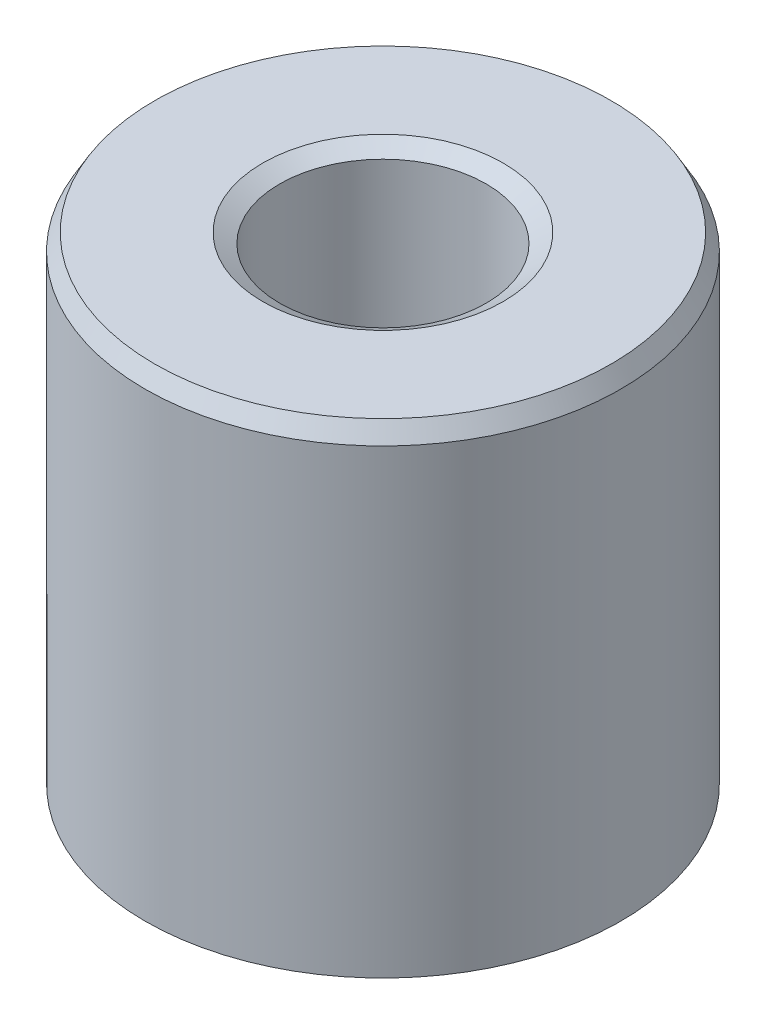
from build123d import *
from OCP.BRepFilletAPI import BRepFilletAPI_MakeChamfer

# Parameters (mm, degrees)
SKETCH1_R           = 32.5
BOSS_EXTRUDE1_DEPTH = 66.569954093
SKETCH2_R           = 14.112686243
CUT_EXTRUDE1_DEPTH  = 81.895357023
CHAMFER1_SIZE       = 2.299451294
CHAMFER1_SIZE2      = 1.327588824


with BuildPart() as part:
    # Sketch1 → Boss-Extrude1 (new body)
    with BuildSketch(Plane(origin=(0, 0, 0), x_dir=(1, 0, 0), z_dir=(0, 1, 0))):
        Circle(SKETCH1_R)
    extrude(amount=BOSS_EXTRUDE1_DEPTH)

    # Sketch2 → Cut-Extrude1 (cut, through all)
    with BuildSketch(Plane(origin=(0, 0, 0), x_dir=(1, 0, 0), z_dir=(0, 1, 0))):
        Circle(SKETCH2_R)
    extrude(amount=CUT_EXTRUDE1_DEPTH, mode=Mode.SUBTRACT)

    # Chamfer1: one chamfer whose edges measure the first distance from different faces: ONE call of the kernel's chamfer builder (chamfer() names one face for all edges)
    chamfer1_edges_1 = [part.edges().sort_by_distance(p)[0] for p in [
        (-14.112686243, 66.569954093, 0),
    ]]
    chamfer1_side_1 = [part.faces().sort_by_distance(p)[0] for p in [
        (-31.580761184, 66.569954093, 0),
    ]]
    chamfer1_edges_2 = [part.edges().sort_by_distance(p)[0] for p in [
        (-14.112686243, 0, 0),
    ]]
    chamfer1_side_2 = [part.faces().sort_by_distance(p)[0] for p in [
        (-14.112686243, 33.284977046, 0),
    ]]
    chamfer1_edges_3 = [part.edges().sort_by_distance(p)[0] for p in [
        (-32.5, 0, 0),
    ]]
    chamfer1_side_3 = [part.faces().sort_by_distance(p)[0] for p in [
        (-31.580761184, 0, 0),
    ]]
    chamfer1_edges_4 = [part.edges().sort_by_distance(p)[0] for p in [
        (-32.5, 66.569954093, 0),
    ]]
    chamfer1_side_4 = [part.faces().sort_by_distance(p)[0] for p in [
        (-32.5, 33.284977046, 0),
    ]]
    chamfer1 = BRepFilletAPI_MakeChamfer(part.part.solid().wrapped)
    for e in chamfer1_edges_1:
        chamfer1.Add(CHAMFER1_SIZE, CHAMFER1_SIZE2, e.wrapped, chamfer1_side_1[0].wrapped)  # the first distance lies on this face
    for e in chamfer1_edges_2:
        chamfer1.Add(CHAMFER1_SIZE, CHAMFER1_SIZE2, e.wrapped, chamfer1_side_2[0].wrapped)  # the first distance lies on this face
    for e in chamfer1_edges_3:
        chamfer1.Add(CHAMFER1_SIZE, CHAMFER1_SIZE2, e.wrapped, chamfer1_side_3[0].wrapped)  # the first distance lies on this face
    for e in chamfer1_edges_4:
        chamfer1.Add(CHAMFER1_SIZE, CHAMFER1_SIZE2, e.wrapped, chamfer1_side_4[0].wrapped)  # the first distance lies on this face
    add(Compound.cast(chamfer1.Shape()), mode=Mode.REPLACE)


solid = part.part
